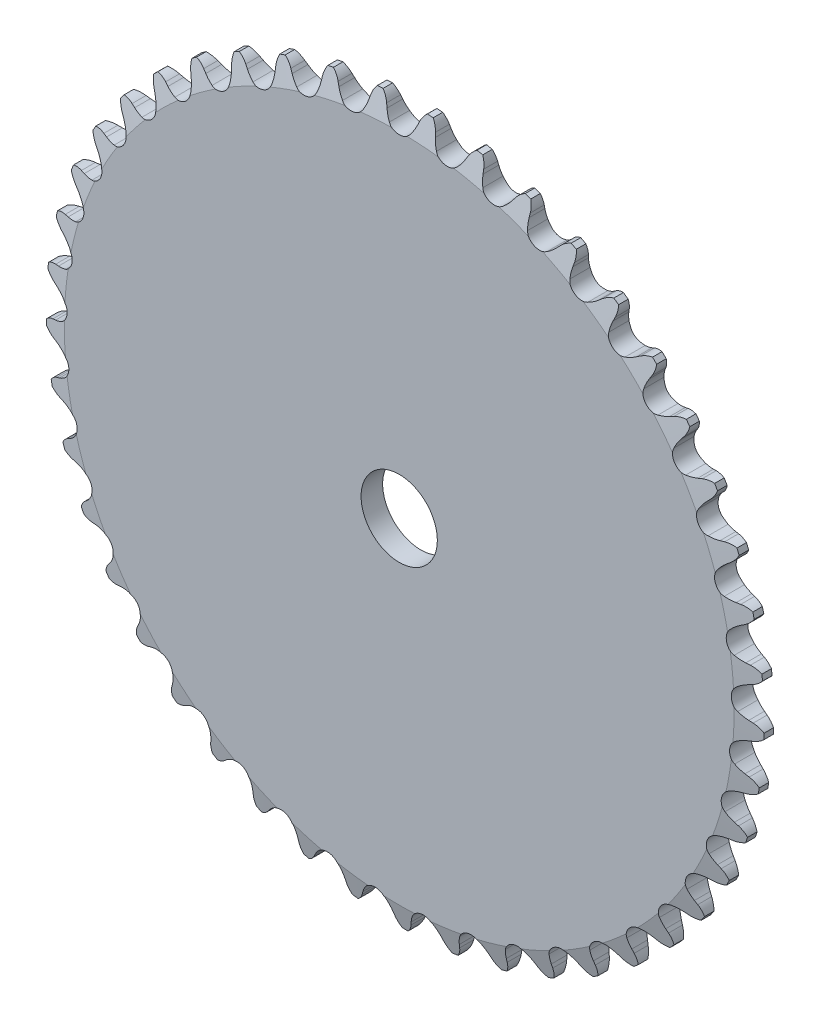
from build123d import *

# Parameters (mm, degrees)
CUT_EXTRUDE1_DEPTH      = 101.381526816
CIRPATTERN1_START       = -2.1336
CIRPATTERN1_DEPTH       = 4.2672
CUT_EXTRUDE2_DEPTH      = 101.363515374
CUT_EXTRUDE2_DEPTH_BACK = 101.363515374
SKETCH3_OUTSIDE_W       = 184.004
SKETCH3_OUTSIDE_H       = 183.919
SKETCH3_OUTSIDE_R       = 70.993
SKETCH3_OUTSIDE_R_2     = 7.540625


# Read off the part's stored shape, not the designer's step: CirPattern1
with BuildPart() as part:
    # Sketch1 → Revolve1 (revolve)
    with BuildSketch(Plane(origin=(0, 0, 0), x_dir=(0, 0, -1), z_dir=(1, 0, 0)), mode=Mode.PRIVATE) as revolve1_sk:
        Polygon((2.1336, 0), (-2.1336, 0), (-2.1336, 66.201923048), (-0.942975, 70.964423048), (0.942975, 70.964423048), (2.1336, 66.201923048), align=None)
    revolve(revolve1_sk.sketch.rotate(Axis((0, 0, -2.1336), (0, 0, 1)), 90), axis=Axis((0, 0, -2.1336), (0, 0, 1)))

    # Sketch0 → Cut-Extrude1 (cut, symmetric)
    with BuildSketch(Plane.XY):
        with BuildLine():
            Line((8.059102042, -68.752061704), (7.763789226, -68.075402129))
            ThreePointArc((7.763789226, -68.075402129), (7.310869953, -67.215151558), (6.73744589, -66.430070826))
            ThreePointArc((6.73744589, -66.430070826), (4.581774928, -65.522434106), (2.573401424, -66.72124918))
            ThreePointArc((2.573401424, -66.72124918), (2.114820005, -67.578494766), (1.78603225, -68.493407616))
            Line((1.78603225, -68.493407616), (1.587766209, -69.204581588))
            ThreePointArc((1.587766209, -69.204581588), (0.065884539, -71.404321568), (-2.49042048, -72.191902961))
            ThreePointArc((-2.49042048, -72.191902961), (5.038848173, -72.058886033), (12.513354879, -71.142736783))
            ThreePointArc((12.513354879, -71.142736783), (9.8723175, -70.718588975), (8.059102042, -68.752061704))
        make_face()
    extrude(amount=CUT_EXTRUDE1_DEPTH, both=True, mode=Mode.SUBTRACT)

    # CirPattern1 outline → CirPattern1 (cut)
    with BuildSketch(Plane.XY.offset(CIRPATTERN1_START)):
        with BuildLine():
            ThreePointArc((-8.059102042, -68.752061704), (-8.581878039, -69.63040017), (-9.306231041, -70.351570006))
            ThreePointArc((-9.306231041, -70.351570006), (-4.950227913, -70.79155728), (-0.575382714, -70.962090395))
            ThreePointArc((-0.575382714, -70.962090395), (-1.192318921, -70.147128481), (-1.58776621, -69.204581587))
            Line((-1.58776621, -69.204581587), (-1.78603225, -68.493407616))
            ThreePointArc((-1.78603225, -68.493407616), (-2.114820005, -67.578494766), (-2.573401424, -66.72124918))
            ThreePointArc((-2.573401424, -66.72124918), (-4.581774928, -65.522434106), (-6.73744589, -66.430070826))
            ThreePointArc((-6.73744589, -66.430070826), (-7.310869953, -67.215151558), (-7.763789226, -68.075402129))
            Line((-7.763789226, -68.075402129), (-8.059102042, -68.752061704))
        make_face()
        with BuildLine():
            ThreePointArc((-17.54910904, -66.961361143), (-18.189038505, -67.758395323), (-19.006709596, -68.37173633))
            ThreePointArc((-19.006709596, -68.37173633), (-14.754333184, -69.413680142), (-10.4457973, -70.191414413))
            ThreePointArc((-10.4457973, -70.191414413), (-10.943308749, -69.298522727), (-11.203730398, -68.31011301))
            Line((-11.203730398, -68.31011301), (-11.30109064, -67.578266835))
            ThreePointArc((-11.30109064, -67.578266835), (-11.499347396, -66.626499442), (-11.834160407, -65.713774314))
            ThreePointArc((-11.834160407, -65.713774314), (-13.656145746, -64.247114457), (-15.917156483, -64.845906706))
            ThreePointArc((-15.917156483, -64.845906706), (-16.594262143, -65.543541881), (-17.162497376, -66.332386373))
            Line((-17.162497376, -66.332386373), (-17.54910904, -66.961361143))
        make_face()
        with BuildLine():
            ThreePointArc((-26.697542592, -63.867333855), (-27.442170026, -64.567550385), (-28.337244168, -65.061124579))
            ThreePointArc((-28.337244168, -65.061124579), (-24.271262142, -66.684744676), (-20.112896324, -68.05454239))
            ThreePointArc((-20.112896324, -68.05454239), (-20.48129952, -67.101100054), (-20.601626718, -66.086065784))
            Line((-20.601626718, -66.086065784), (-20.596186156, -65.347791959))
            ThreePointArc((-20.596186156, -65.347791959), (-20.660053071, -64.377695093), (-20.864580918, -63.427255578))
            ThreePointArc((-20.864580918, -63.427255578), (-22.464715221, -61.721297805), (-24.787057732, -61.999590774))
            ThreePointArc((-24.787057732, -61.999590774), (-25.554665896, -62.596201717), (-26.227157037, -63.298286168))
            Line((-26.227157037, -63.298286168), (-26.697542592, -63.867333855))
        make_face()
        with BuildLine():
            ThreePointArc((-35.326338845, -59.530201562), (-36.161170922, -60.119971524), (-37.116226515, -60.484172043))
            ThreePointArc((-37.116226515, -60.484172043), (-33.315778591, -62.657866509), (-29.388520698, -64.593066111))
            ThreePointArc((-29.388520698, -64.593066111), (-29.620645093, -63.597630795), (-29.598535809, -62.575728459))
            Line((-29.598535809, -62.575728459), (-29.490400336, -61.845396645))
            ThreePointArc((-29.490400336, -61.845396645), (-29.418634314, -60.875852138), (-29.488896095, -59.90619746))
            ThreePointArc((-29.488896095, -59.90619746), (-30.836034568, -57.994146298), (-33.174507096, -57.94652333))
            ThreePointArc((-33.174507096, -57.94652333), (-34.017677146, -58.430497688), (-34.781334919, -59.032156824))
            Line((-34.781334919, -59.032156824), (-35.326338845, -59.530201562))
        make_face()
        with BuildLine():
            ThreePointArc((-43.267548096, -54.03438161), (-44.176335759, -54.502225802), (-45.172783732, -54.729963899))
            ThreePointArc((-45.172783732, -54.729963899), (-41.711841305, -57.411424242), (-38.092130946, -59.874359274))
            ThreePointArc((-38.092130946, -59.874359274), (-38.183458503, -58.856305994), (-38.019343067, -57.847425759))
            Line((-38.019343067, -57.847425759), (-37.810617418, -57.139251032))
            ThreePointArc((-37.810617418, -57.139251032), (-37.604615303, -56.189129966), (-37.539243453, -55.219133351))
            ThreePointArc((-37.539243453, -55.219133351), (-38.607165555, -53.138204717), (-40.916252415, -52.765592723))
            ThreePointArc((-40.916252415, -52.765592723), (-41.818573004, -53.127510485), (-42.658533681, -53.617033696))
            Line((-42.658533681, -53.617033696), (-43.267548096, -54.03438161))
        make_face()
        with BuildLine():
            ThreePointArc((-50.366603739, -47.486843883), (-51.33165847, -47.823656251), (-52.350104097, -47.910499261))
            ThreePointArc((-52.350104097, -47.910499261), (-49.296030475, -51.047533906), (-46.054321194, -53.990266139))
            ThreePointArc((-46.054321194, -53.990266139), (-46.003074326, -52.969410144), (-45.70014706, -51.993188717))
            Line((-45.70014706, -51.993188717), (-45.394893842, -51.320954894))
            ThreePointArc((-45.394893842, -51.320954894), (-45.058665229, -50.408750294), (-44.858932137, -49.457291622))
            ThreePointArc((-44.858932137, -49.457291622), (-45.626852023, -47.247988393), (-47.861609423, -46.557639874))
            ThreePointArc((-47.861609423, -46.557639874), (-48.805517907, -46.790456723), (-49.705432607, -47.158315995))
            Line((-49.705432607, -47.158315995), (-50.366603739, -47.486843883))
        make_face()
        with BuildLine():
            ThreePointArc((-56.485330732, -40.015028755), (-57.487868838, -40.214253629), (-58.508489234, -40.158511253))
            ThreePointArc((-58.508489234, -40.158511253), (-55.920728485, -43.690061389), (-53.120116467, -47.055313887))
            ThreePointArc((-53.120116467, -47.055313887), (-52.927292635, -46.051524978), (-52.491449672, -45.126963398))
            Line((-52.491449672, -45.126963398), (-52.095610292, -44.503754745))
            ThreePointArc((-52.095610292, -44.503754745), (-51.635699491, -43.647221636), (-51.305492733, -42.732819969))
            ThreePointArc((-51.305492733, -42.732819969), (-51.758463694, -40.438143734), (-53.875394644, -39.443495522))
            ThreePointArc((-53.875394644, -39.443495522), (-54.842518919, -39.542679943), (-55.784871827, -39.781715315))
            Line((-55.784871827, -39.781715315), (-56.485330732, -40.015028755))
        make_face()
        with BuildLine():
            ThreePointArc((-61.504635013, -31.76436661), (-62.52514323, -31.822126303), (-63.528073179, -31.624883503))
            ThreePointArc((-63.528073179, -31.624883503), (-61.456993124, -35.482211524), (-59.151989095, -39.204483475))
            ThreePointArc((-59.151989095, -39.204483475), (-58.821341396, -38.237299262), (-58.261065926, -37.382393067))
            Line((-58.261065926, -37.382393067), (-57.782344946, -36.820339632))
            ThreePointArc((-57.782344946, -36.820339632), (-57.207703596, -36.036149457), (-56.753450273, -35.176602582))
            ThreePointArc((-56.753450273, -35.176602582), (-56.882655744, -32.841216606), (-58.840556592, -31.561628397))
            ThreePointArc((-58.840556592, -31.561628397), (-59.812072682, -31.525249878), (-60.778521971, -31.630808797))
            Line((-60.778521971, -31.630808797), (-61.504635013, -31.76436661))
        make_face()
        with BuildLine():
            ThreePointArc((-65.326821534, -22.895447199), (-66.345436832, -22.810617486), (-67.311155443, -22.475713368))
            ThreePointArc((-67.311155443, -22.475713368), (-65.797067298, -26.583740772), (-64.03253554, -30.590582387))
            ThreePointArc((-64.03253554, -30.590582387), (-63.570499656, -29.678828009), (-62.896696801, -28.910216977))
            Line((-62.896696801, -28.910216977), (-62.344411982, -28.420258491))
            ThreePointArc((-62.344411982, -28.420258491), (-61.666224824, -27.72367462), (-61.096766459, -26.935712639))
            ThreePointArc((-61.096766459, -26.935712639), (-60.899691603, -24.605072553), (-62.660454035, -23.065450076))
            ThreePointArc((-62.660454035, -23.065450076), (-63.617452487, -22.894216683), (-64.589187319, -22.864244566))
            Line((-64.589187319, -22.864244566), (-65.326821534, -22.895447199))
        make_face()
        with BuildLine():
            ThreePointArc((-67.877495782, -13.580893952), (-68.874391971, -13.355125946), (-69.784102631, -12.889079039))
            ThreePointArc((-69.784102631, -12.889079039), (-68.856476401, -17.167847744), (-67.666761517, -21.381270408))
            ThreePointArc((-67.666761517, -21.381270408), (-67.08233045, -20.542692128), (-66.308115018, -19.875336399))
            Line((-66.308115018, -19.875336399), (-65.693015955, -19.467009346))
            ThreePointArc((-65.693015955, -19.467009346), (-64.92448313, -18.871589991), (-64.250903582, -18.170549689))
            ThreePointArc((-64.250903582, -18.170549689), (-63.731384237, -15.89001875), (-65.260737016, -14.120329006))
            ThreePointArc((-65.260737016, -14.120329006), (-66.184590942, -13.817573602), (-67.142697605, -13.652653822))
            Line((-67.142697605, -13.652653822), (-67.877495782, -13.580893952))
        make_face()
        with BuildLine():
            ThreePointArc((-69.107011784, -4.002004052), (-70.062785415, -3.639692071), (-70.89878164, -3.051573447))
            ThreePointArc((-70.89878164, -3.051573447), (-70.575672513, -7.417802088), (-69.983930951, -11.755796322))
            ThreePointArc((-69.983930951, -11.755796322), (-69.288479987, -11.006716112), (-68.4289212, -10.453605006))
            Line((-68.4289212, -10.453605006), (-67.762980096, -10.134857008))
            ThreePointArc((-67.762980096, -10.134857008), (-66.919060222, -9.652191329), (-66.154469951, -9.051717658))
            ThreePointArc((-66.154469951, -9.051717658), (-65.322617971, -6.865683807), (-66.590793984, -4.900371793))
            ThreePointArc((-66.590793984, -4.900371793), (-67.463521619, -4.471987169), (-68.389351657, -4.175329701))
            Line((-68.389351657, -4.175329701), (-69.107011784, -4.002004052))
        make_face()
        with BuildLine():
            ThreePointArc((-68.99143841, 5.654780304), (-69.887486435, 6.14658427), (-70.63349651, 6.845327551))
            ThreePointArc((-70.63349651, 6.845327551), (-70.921193439, 2.476622648), (-70.938942774, -1.901509033))
            ThreePointArc((-70.938942774, -1.901509033), (-70.146008076, -1.256506887), (-69.217836268, -0.828406082))
            Line((-69.217836268, -0.828406082), (-68.51401491, -0.605441206))
            ThreePointArc((-68.51401491, -0.605441206), (-67.611133926, -0.244923742), (-66.770414813, 0.243295762))
            ThreePointArc((-66.770414813, 0.243295762), (-65.642421249, 2.292283861), (-66.624736893, 4.414965582))
            ThreePointArc((-66.624736893, 4.414965582), (-67.429351585, 4.960641409), (-68.304884769, 5.383262463))
            Line((-68.304884769, 5.383262463), (-68.99143841, 5.654780304))
        make_face()
        with BuildLine():
            ThreePointArc((-67.533025164, 15.201500794), (-68.351907029, 15.81322434), (-68.993410715, 16.608992035))
            ThreePointArc((-68.993410715, 16.608992035), (-69.886314005, 12.322842741), (-70.513208768, 7.989788967))
            ThreePointArc((-70.513208768, 7.989788967), (-69.638223906, 8.518158815), (-68.659504886, 8.812916824))
            Line((-68.659504886, 8.812916824), (-67.931502357, 8.935758821))
            ThreePointArc((-67.931502357, 8.935758821), (-66.987233816, 9.167111007), (-66.0867495, 9.533573706))
            ThreePointArc((-66.0867495, 9.533573706), (-64.684569464, 11.405634832), (-65.361905083, 13.644370675))
            ThreePointArc((-65.361905083, 13.644370675), (-66.082745924, 14.296716743), (-66.890940996, 14.837075547))
            Line((-66.890940996, 14.837075547), (-67.533025164, 15.201500794))
        make_face()
        with BuildLine():
            ThreePointArc((-64.760158401, 24.452341363), (-65.4859355, 25.172077985), (-66.010446659, 26.049381381))
            ThreePointArc((-66.010446659, 26.049381381), (-67.491176965, 21.929212718), (-68.715015361, 17.725574813))
            ThreePointArc((-68.715015361, 17.725574813), (-67.775010922, 18.127028246), (-66.764794342, 18.282706329))
            Line((-66.764794342, 18.282706329), (-66.026780381, 18.303034466))
            ThreePointArc((-66.026780381, 18.303034466), (-65.059503395, 18.400718368), (-64.116780781, 18.638291483))
            ThreePointArc((-64.116780781, 18.638291483), (-62.467706113, 20.296988095), (-62.826878138, 22.608203612))
            ThreePointArc((-62.826878138, 22.608203612), (-63.44991478, 23.354522749), (-64.175041143, 24.002101833))
            Line((-64.175041143, 24.002101833), (-64.760158401, 24.452341363))
        make_face()
        with BuildLine():
            ThreePointArc((-60.726808818, 33.227244921), (-61.345354727, 34.040985766), (-61.742664345, 34.98274915))
            ThreePointArc((-61.742664345, 34.98274915), (-63.782400934, 31.108755513), (-65.579362342, 27.116352508))
            ThreePointArc((-65.579362342, 27.116352508), (-64.592634442, 27.383075691), (-63.570583019, 27.396643751))
            Line((-63.570583019, 27.396643751), (-62.836922229, 27.314062365))
            ThreePointArc((-62.836922229, 27.314062365), (-61.865463745, 27.276176676), (-60.898851856, 27.380236116))
            ThreePointArc((-60.898851856, 27.380236116), (-59.034979925, 28.793283556), (-59.068997475, 31.131993583))
            ThreePointArc((-59.068997475, 31.131993583), (-59.582103219, 31.957759535), (-60.210047113, 32.699954508))
            Line((-60.210047113, 32.699954508), (-60.726808818, 33.227244921))
        make_face()
        with BuildLine():
            ThreePointArc((-55.511480977, 41.355417952), (-56.010756403, 42.247324479), (-56.2731313, 43.235217498))
            ThreePointArc((-56.2731313, 43.235217498), (-58.832173021, 39.682801767), (-61.16728163, 35.979341245))
            ThreePointArc((-61.16728163, 35.979341245), (-60.153035806, 36.106142715), (-59.139042608, 35.977336666))
            Line((-59.139042608, 35.977336666), (-58.424014863, 35.793453109))
            ThreePointArc((-58.424014863, 35.793453109), (-57.467283214, 35.620735231), (-56.49559605, 35.589255598))
            ThreePointArc((-56.49559605, 35.589255598), (-54.453205001, 36.729150519), (-54.161405977, 39.049834743))
            ThreePointArc((-54.161405977, 39.049834743), (-54.554593792, 39.938974882), (-55.073133003, 40.761339764))
            Line((-55.073133003, 40.761339764), (-55.511480977, 41.355417952))
        make_face()
        with BuildLine():
            ThreePointArc((-49.215685302, 48.678654814), (-49.585972417, 49.631367077), (-49.708305765, 50.646161517))
            ThreePointArc((-49.708305765, 50.646161517), (-52.736843781, 47.484467424), (-55.564649359, 44.142033031))
            ThreePointArc((-55.564649359, 44.142033031), (-54.542626752, 44.126444741), (-53.556428003, 43.857771647))
            Line((-53.556428003, 43.857771647), (-52.873950503, 43.576165003))
            ThreePointArc((-52.873950503, 43.576165003), (-51.950567384, 43.271976693), (-50.992717731, 43.105570702))
            ThreePointArc((-50.992717731, 43.105570702), (-48.811560366, 43.950126362), (-48.199624298, 46.207615224))
            ThreePointArc((-48.199624298, 46.207615224), (-48.465241252, 47.142823514), (-48.864283004, 48.029351907))
            Line((-48.864283004, 48.029351907), (-49.215685302, 48.678654814))
        make_face()
        with BuildLine():
            ThreePointArc((-41.961962295, 55.054417031), (-42.196053881, 56.04939157), (-42.1759646, 57.071335612))
            ThreePointArc((-42.1759646, 57.071335612), (-45.615051864, 54.361901935), (-48.880514391, 51.445550355))
            ThreePointArc((-48.880514391, 51.445550355), (-47.870607508, 51.287875714), (-46.931398446, 50.884564989))
            Line((-46.931398446, 50.884564989), (-46.29475484, 50.510716412))
            ThreePointArc((-46.29475484, 50.510716412), (-45.422692852, 50.08097835), (-44.497324164, 49.782884904))
            ThreePointArc((-44.497324164, 49.782884904), (-42.219854243, 50.315662973), (-41.299691768, 52.466017068))
            ThreePointArc((-41.299691768, 52.466017068), (-41.432567919, 53.42909071), (-41.704345319, 54.362527348))
            Line((-41.704345319, 54.362527348), (-41.961962295, 55.054417031))
        make_face()
        with BuildLine():
            ThreePointArc((-33.891497422, 60.358607644), (-33.984837153, 61.376478411), (-33.822716259, 62.385681076))
            ThreePointArc((-33.822716259, 62.385681076), (-37.605414848, 60.18124386), (-41.244975812, 57.74773856))
            ThreePointArc((-41.244975812, 57.74773856), (-40.266841342, 57.451046525), (-39.392902602, 56.920948155))
            Line((-39.392902602, 56.920948155), (-38.814484433, 56.462134181))
            ThreePointArc((-38.814484433, 56.462134181), (-38.010717271, 55.91521073), (-37.135840797, 55.491231878))
            ThreePointArc((-37.135840797, 55.491231878), (-34.806386686, 55.701862433), (-33.595907713, 57.70322762))
            ThreePointArc((-33.595907713, 57.70322762), (-33.593456781, 58.67542143), (-33.73267999, 59.63759803))
            Line((-33.73267999, 59.63759803), (-33.891497422, 60.358607644))
        make_face()
        with BuildLine():
            ThreePointArc((-25.161373104, 64.487986616), (-25.112144228, 65.508941915), (-24.811147218, 66.485760221))
            ThreePointArc((-24.811147218, 66.485760221), (-28.863831208, 64.82922633), (-32.806650694, 62.925932721))
            ThreePointArc((-32.806650694, 62.925932721), (-31.879326912, 62.495998065), (-31.087668717, 61.849429811))
            Line((-31.087668717, 61.849429811), (-30.578734238, 61.314580733))
            ThreePointArc((-30.578734238, 61.314580733), (-29.858906316, 60.661117135), (-29.051550531, 60.119505145))
            ThreePointArc((-29.051550531, 60.119505145), (-26.715452394, 60.003888508), (-25.238217536, 61.817310381))
            ThreePointArc((-25.238217536, 61.817310381), (-25.100487218, 62.779701814), (-25.104446416, 63.751890703))
            Line((-25.104446416, 63.751890703), (-25.161373104, 64.487986616))
        make_face()
        with BuildLine():
            ThreePointArc((-15.941511279, 67.362180282), (-15.75067198, 68.366348379), (-15.31665742, 69.29176967))
            ThreePointArc((-15.31665742, 69.29176967), (-19.560445926, 68.21538165), (-23.729781437, 66.879345178))
            ThreePointArc((-23.729781437, 66.879345178), (-22.871317646, 66.324536091), (-22.177348723, 65.574082669))
            Line((-22.177348723, 65.574082669), (-21.747803764, 64.973608716))
            ThreePointArc((-21.747803764, 64.973608716), (-21.125925713, 64.226323896), (-20.401804879, 63.577620628))
            ThreePointArc((-20.401804879, 63.577620628), (-18.104532214, 63.138007143), (-16.38929416, 64.728189563))
            ThreePointArc((-16.38929416, 64.728189563), (-16.118965223, 65.662046713), (-15.987583348, 66.625325341))
            Line((-15.987583348, 66.625325341), (-15.941511279, 67.362180282))
        make_face()
        with BuildLine():
            ThreePointArc((-6.411366069, 68.925245733), (-6.082630818, 69.893081638), (-5.524046307, 70.74909364))
            ThreePointArc((-5.524046307, 70.74909364), (-9.876338813, 70.273802161), (-14.191038976, 69.531027256))
            ThreePointArc((-14.191038976, 69.531027256), (-13.418144197, 68.862142464), (-12.835371862, 68.022410597))
            Line((-12.835371862, 68.022410597), (-12.493577027, 67.367999311))
            ThreePointArc((-12.493577027, 67.367999311), (-11.981752996, 66.541438319), (-11.354961302, 65.798270045))
            ThreePointArc((-11.354961302, 65.798270045), (-9.141227909, 65.043216287), (-7.221371814, 66.379208162))
            ThreePointArc((-7.221371814, 66.379208162), (-6.823705905, 67.266354563), (-6.559540155, 68.201973806))
            Line((-6.559540155, 68.201973806), (-6.411366069, 68.925245733))
        make_face()
        with BuildLine():
            ThreePointArc((3.243569088, 69.146759677), (3.703801834, 70.059425565), (4.376084084, 70.829366978))
            ThreePointArc((4.376084084, 70.829366978), (0, 70.964423048), (-4.376084084, 70.829366979))
            ThreePointArc((-4.376084084, 70.829366979), (-3.703801834, 70.059425565), (-3.243569088, 69.146759677))
            Line((-3.243569088, 69.146759677), (-2.996177025, 68.45114843))
            ThreePointArc((-2.996177025, 68.45114843), (-2.604369087, 67.561399335), (-2.087106319, 66.73823098))
            ThreePointArc((-2.087106319, 66.73823098), (0, 65.682433212), (2.087106319, 66.73823098))
            ThreePointArc((2.087106319, 66.73823098), (2.604369087, 67.561399335), (2.996177025, 68.45114843))
            Line((2.996177025, 68.45114843), (3.243569088, 69.146759677))
        make_face()
        with BuildLine():
            ThreePointArc((12.835371862, 68.022410597), (13.418144197, 68.862142464), (14.191038976, 69.531027256))
            ThreePointArc((14.191038976, 69.531027256), (9.876338813, 70.273802161), (5.524046307, 70.74909364))
            ThreePointArc((5.524046307, 70.74909364), (6.082630818, 69.893081638), (6.411366069, 68.925245733))
            Line((6.411366069, 68.925245733), (6.559540155, 68.201973806))
            ThreePointArc((6.559540155, 68.201973806), (6.823705905, 67.266354563), (7.221371814, 66.379208162))
            ThreePointArc((7.221371814, 66.379208162), (9.141227909, 65.043216287), (11.354961302, 65.798270045))
            ThreePointArc((11.354961302, 65.798270045), (11.981752996, 66.541438319), (12.493577027, 67.367999311))
            Line((12.493577027, 67.367999311), (12.835371862, 68.022410597))
        make_face()
        with BuildLine():
            ThreePointArc((22.177348723, 65.574082669), (22.871317646, 66.324536091), (23.729781437, 66.879345178))
            ThreePointArc((23.729781437, 66.879345178), (19.560445926, 68.21538165), (15.31665742, 69.29176967))
            ThreePointArc((15.31665742, 69.29176967), (15.75067198, 68.366348379), (15.941511279, 67.362180282))
            Line((15.941511279, 67.362180282), (15.987583348, 66.625325341))
            ThreePointArc((15.987583348, 66.625325341), (16.118965223, 65.662046713), (16.38929416, 64.728189563))
            ThreePointArc((16.38929416, 64.728189563), (18.104532214, 63.138007143), (20.401804879, 63.577620628))
            ThreePointArc((20.401804879, 63.577620628), (21.125925713, 64.226323896), (21.747803764, 64.973608716))
            Line((21.747803764, 64.973608716), (22.177348723, 65.574082669))
        make_face()
        with BuildLine():
            ThreePointArc((31.087668717, 61.849429811), (31.879326912, 62.495998065), (32.806650694, 62.925932721))
            ThreePointArc((32.806650694, 62.925932721), (28.863831208, 64.82922633), (24.811147218, 66.485760222))
            ThreePointArc((24.811147218, 66.485760222), (25.112144228, 65.508941915), (25.161373104, 64.487986616))
            Line((25.161373104, 64.487986616), (25.104446416, 63.751890703))
            ThreePointArc((25.104446416, 63.751890703), (25.100487218, 62.779701814), (25.238217536, 61.81731038))
            ThreePointArc((25.238217536, 61.81731038), (26.715452369, 60.003888519), (29.051550531, 60.119505145))
            ThreePointArc((29.051550531, 60.119505145), (29.858906316, 60.661117135), (30.578734238, 61.314580733))
            Line((30.578734238, 61.314580733), (31.087668717, 61.849429811))
        make_face()
        with BuildLine():
            ThreePointArc((39.392902602, 56.920948155), (40.266841342, 57.451046525), (41.244975812, 57.74773856))
            ThreePointArc((41.244975812, 57.74773856), (37.605414848, 60.181243861), (33.822716259, 62.385681076))
            ThreePointArc((33.822716259, 62.385681076), (33.984837154, 61.376478411), (33.891497422, 60.358607644))
            Line((33.891497422, 60.358607644), (33.73267999, 59.63759803))
            ThreePointArc((33.73267999, 59.63759803), (33.593456781, 58.67542143), (33.595907717, 57.703227568))
            ThreePointArc((33.595907717, 57.703227568), (34.806386686, 55.701862433), (37.135840857, 55.491231902))
            ThreePointArc((37.135840857, 55.491231902), (38.010717271, 55.91521073), (38.814484433, 56.462134181))
            Line((38.814484433, 56.462134181), (39.392902602, 56.920948155))
        make_face()
        with BuildLine():
            ThreePointArc((46.931398446, 50.884564989), (47.870607508, 51.287875714), (48.880514391, 51.445550355))
            ThreePointArc((48.880514391, 51.445550355), (45.615051864, 54.361901935), (42.1759646, 57.071335612))
            ThreePointArc((42.1759646, 57.071335612), (42.196053881, 56.04939157), (41.961962295, 55.054417031))
            Line((41.961962295, 55.054417031), (41.704345319, 54.362527348))
            ThreePointArc((41.704345319, 54.362527348), (41.432567919, 53.42909071), (41.299691768, 52.466017067))
            ThreePointArc((41.299691768, 52.466017067), (42.219854243, 50.315662973), (44.497324164, 49.782884904))
            ThreePointArc((44.497324164, 49.782884904), (45.422692852, 50.08097835), (46.29475484, 50.510716412))
            Line((46.29475484, 50.510716412), (46.931398446, 50.884564989))
        make_face()
        with BuildLine():
            ThreePointArc((53.556428003, 43.857771647), (54.542626752, 44.126444741), (55.564649359, 44.142033031))
            ThreePointArc((55.564649359, 44.142033031), (52.736843781, 47.484467424), (49.708305765, 50.646161517))
            ThreePointArc((49.708305765, 50.646161517), (49.585972417, 49.631367077), (49.215685302, 48.678654814))
            Line((49.215685302, 48.678654814), (48.864283004, 48.029351907))
            ThreePointArc((48.864283004, 48.029351907), (48.465241252, 47.142823514), (48.199624297, 46.207615224))
            ThreePointArc((48.199624297, 46.207615224), (48.811560366, 43.950126362), (50.992717731, 43.105570702))
            ThreePointArc((50.992717731, 43.105570702), (51.950567384, 43.271976693), (52.873950503, 43.576165003))
            Line((52.873950503, 43.576165003), (53.556428003, 43.857771647))
        make_face()
        with BuildLine():
            ThreePointArc((59.139042608, 35.977336666), (60.153035806, 36.106142715), (61.16728163, 35.979341245))
            ThreePointArc((61.16728163, 35.979341245), (58.832173021, 39.682801767), (56.273131301, 43.235217499))
            ThreePointArc((56.273131301, 43.235217499), (56.010756403, 42.247324479), (55.511480977, 41.355417952))
            Line((55.511480977, 41.355417952), (55.073133003, 40.761339764))
            ThreePointArc((55.073133003, 40.761339764), (54.554593792, 39.938974882), (54.161405966, 39.04983471))
            ThreePointArc((54.161405966, 39.04983471), (54.453205001, 36.729150519), (56.495596124, 35.589255595))
            ThreePointArc((56.495596124, 35.589255595), (57.467283214, 35.620735231), (58.424014863, 35.793453109))
            Line((58.424014863, 35.793453109), (59.139042608, 35.977336666))
        make_face()
        with BuildLine():
            ThreePointArc((63.570583019, 27.396643751), (64.592634442, 27.383075691), (65.579362342, 27.116352508))
            ThreePointArc((65.579362342, 27.116352508), (63.782400934, 31.108755513), (61.742664345, 34.98274915))
            ThreePointArc((61.742664345, 34.98274915), (61.345354727, 34.040985766), (60.726808818, 33.227244921))
            Line((60.726808818, 33.227244921), (60.210047113, 32.699954508))
            ThreePointArc((60.210047113, 32.699954508), (59.582103219, 31.957759535), (59.068997475, 31.131993583))
            ThreePointArc((59.068997475, 31.131993583), (59.034979925, 28.793283556), (60.89885189, 27.38023611))
            ThreePointArc((60.89885189, 27.38023611), (61.865463745, 27.276176676), (62.836922229, 27.314062365))
            Line((62.836922229, 27.314062365), (63.570583019, 27.396643751))
        make_face()
        with BuildLine():
            ThreePointArc((66.764794342, 18.282706329), (67.775010922, 18.127028246), (68.715015361, 17.725574813))
            ThreePointArc((68.715015361, 17.725574813), (67.491176965, 21.929212718), (66.010446659, 26.049381381))
            ThreePointArc((66.010446659, 26.049381381), (65.4859355, 25.172077985), (64.760158401, 24.452341363))
            Line((64.760158401, 24.452341363), (64.175041143, 24.002101833))
            ThreePointArc((64.175041143, 24.002101833), (63.44991478, 23.354522749), (62.826878138, 22.608203612))
            ThreePointArc((62.826878138, 22.608203612), (62.467706113, 20.296988095), (64.116780781, 18.638291483))
            ThreePointArc((64.116780781, 18.638291483), (65.059503395, 18.400718368), (66.026780381, 18.303034466))
            Line((66.026780381, 18.303034466), (66.764794342, 18.282706329))
        make_face()
        with BuildLine():
            ThreePointArc((68.659504886, 8.812916824), (69.638223906, 8.518158815), (70.513208768, 7.989788967))
            ThreePointArc((70.513208768, 7.989788967), (69.886314006, 12.322842741), (68.993410715, 16.608992035))
            ThreePointArc((68.993410715, 16.608992035), (68.351907029, 15.81322434), (67.533025164, 15.201500794))
            Line((67.533025164, 15.201500794), (66.890940996, 14.837075547))
            ThreePointArc((66.890940996, 14.837075547), (66.082745924, 14.296716743), (65.361905082, 13.644370674))
            ThreePointArc((65.361905082, 13.644370674), (64.684569464, 11.405634832), (66.0867495, 9.533573706))
            ThreePointArc((66.0867495, 9.533573706), (66.987233816, 9.167111007), (67.931502357, 8.935758821))
            Line((67.931502357, 8.935758821), (68.659504886, 8.812916824))
        make_face()
        with BuildLine():
            ThreePointArc((69.217836268, -0.828406082), (70.146008076, -1.256506887), (70.938942774, -1.901509033))
            ThreePointArc((70.938942774, -1.901509033), (70.921193439, 2.476622648), (70.63349651, 6.845327551))
            ThreePointArc((70.63349651, 6.845327551), (69.887486435, 6.14658427), (68.99143841, 5.654780304))
            Line((68.99143841, 5.654780304), (68.304884769, 5.383262463))
            ThreePointArc((68.304884769, 5.383262463), (67.429351585, 4.960641409), (66.624736893, 4.414965582))
            ThreePointArc((66.624736893, 4.414965582), (65.642421249, 2.292283861), (66.770414813, 0.243295762))
            ThreePointArc((66.770414813, 0.243295762), (67.611133926, -0.244923742), (68.51401491, -0.605441206))
            Line((68.51401491, -0.605441206), (69.217836268, -0.828406082))
        make_face()
        with BuildLine():
            ThreePointArc((68.4289212, -10.453605006), (69.288479987, -11.006716112), (69.983930951, -11.755796322))
            ThreePointArc((69.983930951, -11.755796322), (70.575672513, -7.417802088), (70.89878164, -3.051573447))
            ThreePointArc((70.89878164, -3.051573447), (70.062785415, -3.639692071), (69.107011784, -4.002004052))
            Line((69.107011784, -4.002004052), (68.389351657, -4.175329701))
            ThreePointArc((68.389351657, -4.175329701), (67.463521619, -4.471987169), (66.590793984, -4.900371793))
            ThreePointArc((66.590793984, -4.900371793), (65.322617971, -6.865683807), (66.154469951, -9.051717658))
            ThreePointArc((66.154469951, -9.051717658), (66.919060222, -9.652191329), (67.762980096, -10.134857008))
            Line((67.762980096, -10.134857008), (68.4289212, -10.453605006))
        make_face()
        with BuildLine():
            ThreePointArc((66.308115018, -19.875336399), (67.08233045, -20.542692128), (67.666761517, -21.381270408))
            ThreePointArc((67.666761517, -21.381270408), (68.856476401, -17.167847744), (69.784102631, -12.889079039))
            ThreePointArc((69.784102631, -12.889079039), (68.874391971, -13.355125946), (67.877495782, -13.580893952))
            Line((67.877495782, -13.580893952), (67.142697605, -13.652653822))
            ThreePointArc((67.142697605, -13.652653822), (66.184590942, -13.817573602), (65.260737016, -14.120329006))
            ThreePointArc((65.260737016, -14.120329006), (63.731384237, -15.89001875), (64.250903582, -18.170549689))
            ThreePointArc((64.250903582, -18.170549689), (64.92448313, -18.871589991), (65.693015955, -19.467009346))
            Line((65.693015955, -19.467009346), (66.308115018, -19.875336399))
        make_face()
        with BuildLine():
            ThreePointArc((62.896696801, -28.910216977), (63.570499656, -29.678828009), (64.03253554, -30.590582387))
            ThreePointArc((64.03253554, -30.590582387), (65.797067299, -26.583740772), (67.311155443, -22.475713368))
            ThreePointArc((67.311155443, -22.475713368), (66.345436832, -22.810617486), (65.326821534, -22.895447199))
            Line((65.326821534, -22.895447199), (64.589187319, -22.864244566))
            ThreePointArc((64.589187319, -22.864244566), (63.617452487, -22.894216683), (62.660454035, -23.065450076))
            ThreePointArc((62.660454035, -23.065450076), (60.899691603, -24.605072553), (61.096766459, -26.935712639))
            ThreePointArc((61.096766459, -26.935712639), (61.666224824, -27.72367462), (62.344411982, -28.420258491))
            Line((62.344411982, -28.420258491), (62.896696801, -28.910216977))
        make_face()
        with BuildLine():
            ThreePointArc((58.261065926, -37.382393067), (58.821341396, -38.237299262), (59.151989095, -39.204483475))
            ThreePointArc((59.151989095, -39.204483475), (61.456993124, -35.482211524), (63.52807318, -31.624883503))
            ThreePointArc((63.52807318, -31.624883503), (62.52514323, -31.822126303), (61.504635013, -31.76436661))
            Line((61.504635013, -31.76436661), (60.778521971, -31.630808797))
            ThreePointArc((60.778521971, -31.630808797), (59.812072682, -31.525249878), (58.840556591, -31.561628397))
            ThreePointArc((58.840556591, -31.561628397), (56.882655744, -32.841216606), (56.753450273, -35.176602582))
            ThreePointArc((56.753450273, -35.176602582), (57.207703596, -36.036149457), (57.782344946, -36.820339632))
            Line((57.782344946, -36.820339632), (58.261065926, -37.382393067))
        make_face()
        with BuildLine():
            ThreePointArc((52.491449672, -45.126963398), (52.927292635, -46.051524978), (53.120116467, -47.055313887))
            ThreePointArc((53.120116467, -47.055313887), (55.920728485, -43.690061389), (58.508489234, -40.158511253))
            ThreePointArc((58.508489234, -40.158511253), (57.487868838, -40.214253629), (56.485330732, -40.015028755))
            Line((56.485330732, -40.015028755), (55.784871827, -39.781715315))
            ThreePointArc((55.784871827, -39.781715315), (54.842518919, -39.542679943), (53.875394644, -39.443495522))
            ThreePointArc((53.875394644, -39.443495522), (51.758463694, -40.438143734), (51.305492733, -42.732819969))
            ThreePointArc((51.305492733, -42.732819969), (51.635699491, -43.647221636), (52.095610292, -44.503754745))
            Line((52.095610292, -44.503754745), (52.491449672, -45.126963398))
        make_face()
        with BuildLine():
            ThreePointArc((45.70014706, -51.993188717), (46.003074326, -52.969410144), (46.054321194, -53.990266139))
            ThreePointArc((46.054321194, -53.990266139), (49.296030475, -51.047533906), (52.350104098, -47.910499261))
            ThreePointArc((52.350104098, -47.910499261), (51.33165847, -47.823656251), (50.366603739, -47.486843883))
            Line((50.366603739, -47.486843883), (49.705432607, -47.158315995))
            ThreePointArc((49.705432607, -47.158315995), (48.805517907, -46.790456723), (47.861609422, -46.557639874))
            ThreePointArc((47.861609422, -46.557639874), (45.626852023, -47.247988393), (44.858932137, -49.457291623))
            ThreePointArc((44.858932137, -49.457291623), (45.058665229, -50.408750294), (45.394893842, -51.320954894))
            Line((45.394893842, -51.320954894), (45.70014706, -51.993188717))
        make_face()
        with BuildLine():
            ThreePointArc((38.019343067, -57.847425759), (38.183458503, -58.856305994), (38.092130946, -59.874359274))
            ThreePointArc((38.092130946, -59.874359274), (41.711841305, -57.411424242), (45.172783732, -54.729963899))
            ThreePointArc((45.172783732, -54.729963899), (44.176335759, -54.502225802), (43.267548096, -54.03438161))
            Line((43.267548096, -54.03438161), (42.658533681, -53.617033696))
            ThreePointArc((42.658533681, -53.617033696), (41.818573004, -53.127510485), (40.916252415, -52.765592723))
            ThreePointArc((40.916252415, -52.765592723), (38.607165555, -53.138204717), (37.539243453, -55.219133406))
            ThreePointArc((37.539243453, -55.219133406), (37.604615303, -56.189129966), (37.810617418, -57.139251032))
            Line((37.810617418, -57.139251032), (38.019343067, -57.847425759))
        make_face()
        with BuildLine():
            ThreePointArc((29.598535809, -62.575728459), (29.620645093, -63.597630795), (29.388520698, -64.593066111))
            ThreePointArc((29.388520698, -64.593066111), (33.315778591, -62.657866509), (37.116226515, -60.484172043))
            ThreePointArc((37.116226515, -60.484172043), (36.161170922, -60.119971524), (35.326338845, -59.530201562))
            Line((35.326338845, -59.530201562), (34.781334919, -59.032156824))
            ThreePointArc((34.781334919, -59.032156824), (34.017677146, -58.430497688), (33.174507096, -57.94652333))
            ThreePointArc((33.174507096, -57.94652333), (30.836034579, -57.994146292), (29.488896094, -59.906197468))
            ThreePointArc((29.488896094, -59.906197468), (29.418634314, -60.875852138), (29.490400336, -61.845396645))
            Line((29.490400336, -61.845396645), (29.598535809, -62.575728459))
        make_face()
        with BuildLine():
            ThreePointArc((20.601626718, -66.086065784), (20.48129952, -67.101100054), (20.112896324, -68.05454239))
            ThreePointArc((20.112896324, -68.05454239), (24.271262142, -66.684744676), (28.337244168, -65.061124579))
            ThreePointArc((28.337244168, -65.061124579), (27.442170026, -64.567550385), (26.697542592, -63.867333855))
            Line((26.697542592, -63.867333855), (26.227157037, -63.298286168))
            ThreePointArc((26.227157037, -63.298286168), (25.554665896, -62.596201717), (24.787057732, -61.999590774))
            ThreePointArc((24.787057732, -61.999590774), (22.464715221, -61.721297805), (20.864580918, -63.427255578))
            ThreePointArc((20.864580918, -63.427255578), (20.660053071, -64.377695093), (20.596186156, -65.347791959))
            Line((20.596186156, -65.347791959), (20.601626718, -66.086065784))
        make_face()
        with BuildLine():
            ThreePointArc((19.006709596, -68.37173633), (18.189038505, -67.758395323), (17.54910904, -66.961361143))
            Line((17.54910904, -66.961361143), (17.162497376, -66.332386373))
            ThreePointArc((17.162497376, -66.332386373), (16.594262143, -65.543541881), (15.917156483, -64.845906706))
            ThreePointArc((15.917156483, -64.845906706), (13.656145747, -64.247114457), (11.834160407, -65.713774314))
            ThreePointArc((11.834160407, -65.713774314), (11.499347396, -66.626499442), (11.30109064, -67.578266835))
            Line((11.30109064, -67.578266835), (11.203730398, -68.31011301))
            ThreePointArc((11.203730398, -68.31011301), (10.943308749, -69.298522727), (10.4457973, -70.191414413))
            ThreePointArc((10.4457973, -70.191414413), (14.754333184, -69.413680142), (19.006709596, -68.37173633))
        make_face()
    extrude(amount=CIRPATTERN1_DEPTH, mode=Mode.SUBTRACT)

    # Sketch3 outside → Cut-Extrude2 (cut, two sides: drawn at the far end of the back side and taken through both)
    # profile 1 of 2: a face of its own
    with BuildSketch(Plane.XY.offset(-CUT_EXTRUDE2_DEPTH_BACK)):
        with Locations((0, -0.0675)):
            Rectangle(SKETCH3_OUTSIDE_W, SKETCH3_OUTSIDE_H)
        Circle(SKETCH3_OUTSIDE_R, mode=Mode.SUBTRACT)
    # profile 2 of 2: a face of its own
    with BuildSketch(Plane.XY.offset(-CUT_EXTRUDE2_DEPTH_BACK)):
        Circle(SKETCH3_OUTSIDE_R_2)
    extrude(amount=CUT_EXTRUDE2_DEPTH + CUT_EXTRUDE2_DEPTH_BACK, mode=Mode.SUBTRACT)


solid = part.part
